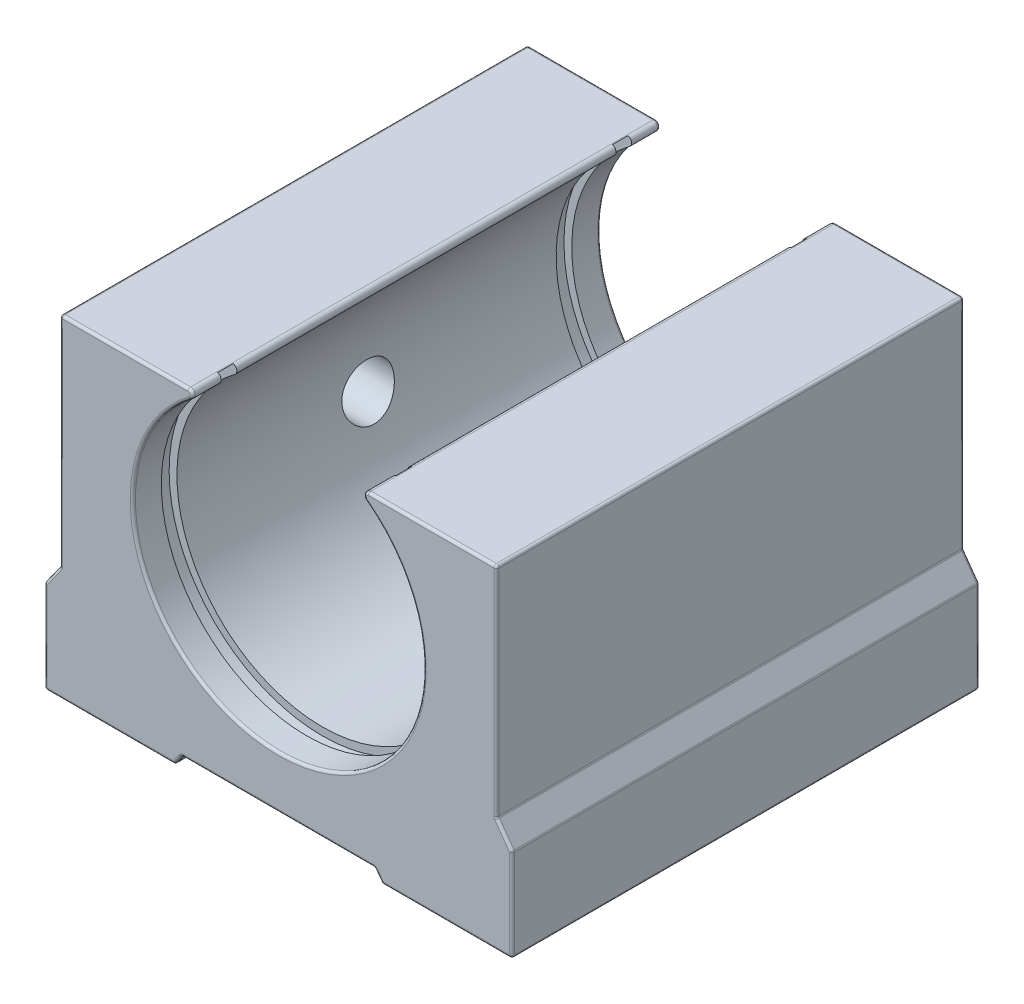
from build123d import *

# Parameters (mm, degrees)
EXTRUDE_START               = -2.75
EXTRUDE_1_DEPTH             = 4.25
EXTRUDE_1_2_DEPTH           = 1.5
EXTRUDE_2_DEPTH             = 36.5
EXTRUDE_3_DEPTH             = 1.5
SKETCH_4_W                  = 42.25
SKETCH_4_H                  = 32
EXTRUDE_4_DEPTH             = 13.816682662
SKETCH_5_W                  = 42.25
SKETCH_5_H                  = 32
EXTRUDE_5_DEPTH             = 13.816682662
EXTRUDE_6_DEPTH             = 2.75
CUT_EXTRUDE_1_DEPTH         = 55.141019569
CUT_EXTRUDE_2_DEPTH         = 55.141019569
CUT_EXTRUDE_3_DEPTH         = 55.141019569
HOLE_WIZARD_5_0_5_1_REACH   = 54.901
HOLE_WIZARD_5_0_5_1_BORE_R  = 2.5
HOLE_WIZARD_3_3_3_3_1_D     = 3.3
HOLE_WIZARD_3_3_3_3_1_DEPTH = 31
HOLE_WIZARD_4_2_4_2_1_D     = 4.2
HOLE_WIZARD_4_2_4_2_1_DEPTH = 16.5
HOLE_WIZARD_4_2_4_2_1_TIP   = 1.2618073
CHAMFER_1_SIZE              = 0.525
CHAMFER_2_SIZE              = 0.425
FILLET_1_R                  = 0.25


with BuildPart() as part:
    # Бобышка-Вытянуть1: read off the stored shape, not the designer's step
    # Бобышка-Вытянуть1 outline → Бобышка-Вытянуть1 (new body)
    with BuildSketch(Plane.XY.offset(-19.75).offset(EXTRUDE_START)):
        with BuildLine():
            Line((-8.683317338, -20), (8.683317338, -20))
            Line((8.683317338, -20), (8.683317338, 12))
            ThreePointArc((8.683317338, 12), (8.256491928, 11.69254848), (8.412902612, 11.190311419))
            ThreePointArc((8.412902612, 11.190311419), (0, 14), (-8.412902612, 11.190311419))
            ThreePointArc((-8.412902612, 11.190311419), (-8.256491928, 11.69254848), (-8.683317338, 12))
            Line((-8.683317338, 12), (-8.683317338, -20))
        make_face()
    extrude(amount=EXTRUDE_1_DEPTH)

    # Extrude 1 2 outline → Extrude 1 2 (add)
    with BuildSketch(Plane.XY.offset(-19.75)):
        with BuildLine():
            ThreePointArc((8.412902612, 11.190311419), (8.244001661, 11.647476849), (8.59040772, 11.990304216))
            ThreePointArc((8.59040772, 11.990304216), (0, 14.75), (-8.59040772, 11.990304216))
            ThreePointArc((-8.59040772, 11.990304216), (-8.244001661, 11.647476849), (-8.412902612, 11.190311419))
            ThreePointArc((-8.412902612, 11.190311419), (0, 14), (8.412902612, 11.190311419))
        make_face()
    extrude(amount=EXTRUDE_1_2_DEPTH)

    # Эскиз2 → Бобышка-Вытянуть2 (add)
    with BuildSketch(Plane.XY.offset(-18.25)):
        with BuildLine():
            Line((8.683317338, 12), (8.683317338, -20))
            Line((8.683317338, -20), (-8.683317338, -20))
            Line((-8.683317338, -20), (-8.683317338, 12))
            ThreePointArc((-8.683317338, 12), (-8.256491928, 11.69254848), (-8.412902612, 11.190311419))
            ThreePointArc((-8.412902612, 11.190311419), (0, 14), (8.412902612, 11.190311419))
            ThreePointArc((8.412902612, 11.190311419), (8.256491928, 11.69254848), (8.683317338, 12))
        make_face()
    extrude(amount=EXTRUDE_2_DEPTH)

    # Эскиз3 → Бобышка-Вытянуть3 (add)
    with BuildSketch(Plane.XY.offset(18.25)):
        with BuildLine():
            Line((8.683317338, 12), (8.683317338, -20))
            Line((8.683317338, -20), (-8.683317338, -20))
            Line((-8.683317338, -20), (-8.683317338, 12))
            ThreePointArc((-8.683317338, 12), (-8.636610258, 11.99756949), (-8.59040772, 11.990304216))
            ThreePointArc((-8.59040772, 11.990304216), (0, 14.75), (8.59040772, 11.990304216))
            ThreePointArc((8.59040772, 11.990304216), (8.636610258, 11.99756949), (8.683317338, 12))
        make_face()
    extrude(amount=EXTRUDE_3_DEPTH)

    # Эскиз4 → Бобышка-Вытянуть4 (add)
    with BuildSketch(Plane(origin=(8.683317338, 0, 0), x_dir=(0, 0, -1), z_dir=(1, 0, 0))):
        with Locations((1.375, -4)):
            Rectangle(SKETCH_4_W, SKETCH_4_H)
    extrude(amount=EXTRUDE_4_DEPTH)

    # Эскиз5 → Бобышка-Вытянуть5 (add)
    with BuildSketch(Plane.ZY.offset(8.683317338)):
        with Locations((-1.375, -4)):
            Rectangle(SKETCH_5_W, SKETCH_5_H)
    extrude(amount=EXTRUDE_5_DEPTH)

    # Эскиз6 → Бобышка-Вытянуть6 (add)
    with BuildSketch(Plane.XY.offset(19.75)):
        with BuildLine():
            Line((22.5, -20), (-22.5, -20))
            Line((-22.5, -20), (-22.5, 12))
            Line((-22.5, 12), (-8.683317338, 12))
            ThreePointArc((-8.683317338, 12), (-8.256491928, 11.69254848), (-8.412902612, 11.190311419))
            ThreePointArc((-8.412902612, 11.190311419), (0, 14), (8.412902612, 11.190311419))
            ThreePointArc((8.412902612, 11.190311419), (8.256491928, 11.69254848), (8.683317338, 12))
            Line((8.683317338, 12), (22.5, 12))
            Line((22.5, 12), (22.5, -20))
        make_face()
    extrude(amount=EXTRUDE_6_DEPTH)

    # Эскиз7 → Вырез-Вытянуть1 (cut, through all)
    with BuildSketch(Plane.XY.offset(22.5)):
        Polygon((10, -20), (9.25, -19), (-9.25, -19), (-10, -20), align=None)
    extrude(amount=-CUT_EXTRUDE_1_DEPTH, mode=Mode.SUBTRACT)

    # Эскиз8 → Вырез-Вытянуть2 (cut, through all)
    with BuildSketch(Plane.XY.offset(22.5)):
        Polygon((-22.5, -11.1), (-21, -9), (-21, 12), (-22.5, 12), align=None)
    extrude(amount=-CUT_EXTRUDE_2_DEPTH, mode=Mode.SUBTRACT)

    # Эскиз9 → Вырез-Вытянуть3 (cut, through all)
    with BuildSketch(Plane.XY.offset(22.5)):
        Polygon((21, -9), (22.5, -11.1), (22.5, 12), (21, 12), align=None)
    extrude(amount=-CUT_EXTRUDE_3_DEPTH, mode=Mode.SUBTRACT)

    # Эскиз10 → Вырез-Повернуть1 (revolve, cut)
    with BuildSketch(Plane.XZ):
        Polygon((14, 22.5), (0, 22.5), (0, -22.5), (14, -22.5), (14, -19.75), (14.75, -19.75), (14.75, -18.25), (14, -18.25), (14, 18.25), (14.75, 18.25), (14.75, 19.75), (14, 19.75), align=None)
    revolve(axis=Axis((0, 0, 22.5), (0, 0, -1)), mode=Mode.SUBTRACT)

    # Диаметр отверстия Ø5.0 (5)1 bore → Диаметр отверстия Ø5.0 (5)1 (cut, up to next)
    with BuildSketch(Plane.ZY.offset(21), mode=Mode.PRIVATE) as hole_wizard_5_0_5_1_sk1:
        with Locations((0, -2)):
            Circle(HOLE_WIZARD_5_0_5_1_BORE_R)
    hole_wizard_5_0_5_1_tool1 = extrude(hole_wizard_5_0_5_1_sk1.sketch, amount=-HOLE_WIZARD_5_0_5_1_REACH, mode=Mode.PRIVATE) & part.part
    add(hole_wizard_5_0_5_1_tool1.solids().sort_by_distance((-21, -2, 0))[0], mode=Mode.SUBTRACT)

    # Диаметр отверстия Ø3.3 (3.3)1
    with Locations(Plane(origin=(0, -19, 0), x_dir=(-1, 0, 0), z_dir=(0, -1, 0))):
        with Locations((0, 0)):
            Hole(HOLE_WIZARD_3_3_3_3_1_D / 2, depth=HOLE_WIZARD_3_3_3_3_1_DEPTH)

    # Диаметр отверстия Ø4.2 (4.2)1
    with Locations(Plane(origin=(0, -20, 0), x_dir=(-1, 0, 0), z_dir=(0, -1, 0))):
        with Locations((-16, 15), (-16, -15), (16, -15), (16, 15)):
            Hole(HOLE_WIZARD_4_2_4_2_1_D / 2, depth=HOLE_WIZARD_4_2_4_2_1_DEPTH)
            with Locations((0, 0, -(HOLE_WIZARD_4_2_4_2_1_DEPTH + HOLE_WIZARD_4_2_4_2_1_TIP / 2))):  # 118° drill point
                Cone(0, HOLE_WIZARD_4_2_4_2_1_D / 2, HOLE_WIZARD_4_2_4_2_1_TIP, mode=Mode.SUBTRACT)

    # Фаска1
    chamfer_1_edges = [part.edges().sort_by_distance(p)[0] for p in [
        (-21, -2, -2.5),
    ]]
    chamfer(chamfer_1_edges, length=CHAMFER_1_SIZE)

    # Фаска2
    chamfer_2_edges = [part.edges().sort_by_distance(p)[0] for p in [
        (-1.65, -19, 0),
        (-18.1, -20, -15),
        (-18.1, -20, 15),
        (13.9, -20, 15),
        (13.9, -20, -15),
    ]]
    chamfer(chamfer_2_edges, length=CHAMFER_2_SIZE)

    # Скругление1
    fillet_1_edges = [part.edges().sort_by_distance(p)[0] for p in [
        (16.25, -20, -22.5),
        (22.5, -20, 0),
        (22.5, -15.55, -22.5),
        (-22.5, -20, 0),
        (22.5, -15.55, 22.5),
        (8.256491928, 11.69254848, 22.5),
        (-8.256491928, 11.69254848, 22.5),
        (-14.841658669, 12, 22.5),
        (-16.25, -20, 22.5),
        (16.25, -20, 22.5),
        (-16.25, -20, -22.5),
        (10, -20, 0),
        (-9.625, -19.5, -22.5),
        (-10, -20, 0),
        (0, -19, -22.5),
        (-9.25, -19, 0),
        (9.625, -19.5, -22.5),
        (9.25, -19, 0),
        (9.625, -19.5, 22.5),
        (0, -19, 22.5),
        (-9.625, -19.5, 22.5),
        (-22.5, -15.55, 22.5),
        (-22.5, -15.55, -22.5),
        (-14.841658669, 12, -22.5),
        (-22.5, -11.1, 0),
        (-21, 1.5, -22.5),
        (-21, 12, 0),
        (-21.75, -10.05, -22.5),
        (-21, -9, 0),
        (-21.75, -10.05, 22.5),
        (-21, 1.5, 22.5),
        (14.841658669, 12, 22.5),
        (14.841658669, 12, -22.5),
        (21, 1.5, -22.5),
        (21, -9, 0),
        (21, 12, 0),
        (21.75, -10.05, -22.5),
        (22.5, -11.1, 0),
        (21, 1.5, 22.5),
        (21.75, -10.05, 22.5),
        (0, -14, 22.5),
        (0, -14, -22.5),
        (-21, -2, -3.025),
        (13.475, -20, 15),
        (13.475, -20, -15),
        (-18.525, -20, -15),
        (-18.525, -20, 15),
        (-2.075, -19, 0),
        (-8.256491928, 11.69254848, -22.5),
        (8.256491928, 11.69254848, -22.5),
    ]]
    fillet(fillet_1_edges, radius=FILLET_1_R)


solid = part.part
